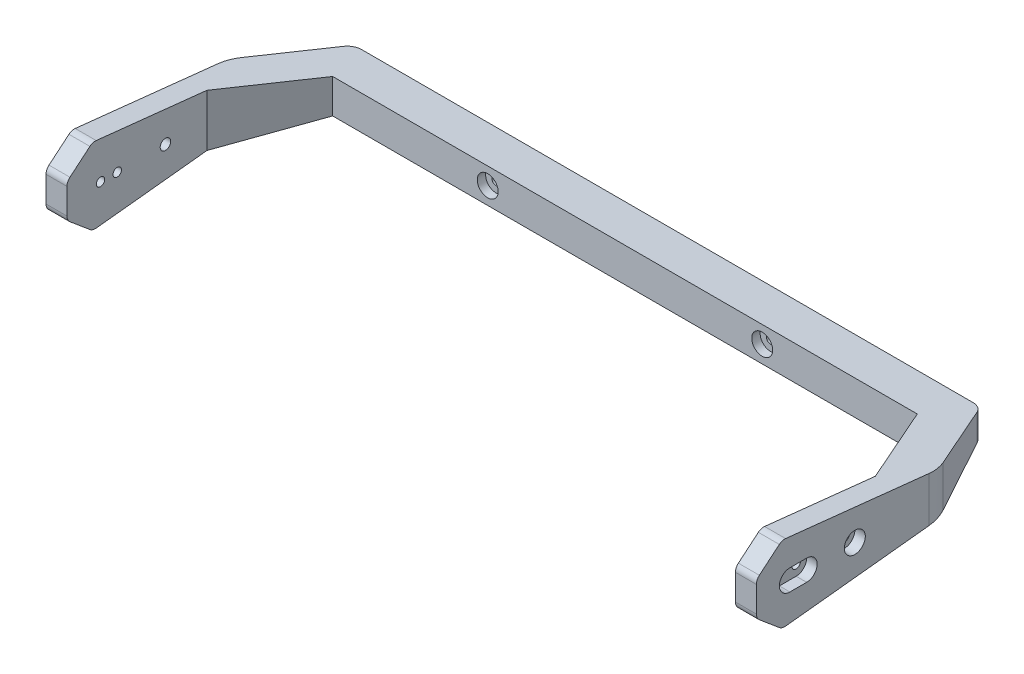
from build123d import *
from OCP.BRepFilletAPI import BRepFilletAPI_MakeChamfer

# Parameters (mm, degrees)
SKETCH4_R                       = 1
SKETCH4_R_2                     = 0.9999999999999998
SKETCH4_R_3                     = 1.250000000000001
BOSS_EXTRUDE1_DEPTH             = 5
BOSS_EXTRUDE2_START             = -79.75
BOSS_EXTRUDE2_DEPTH             = 159.5
BOSS_EXTRUDE3_REACH             = 103.717
SKETCH6_W                       = 14.25
SKETCH6_H                       = 2.1000000000000014
BOSS_EXTRUDE3_DIRECTION_2_REACH = 103.717
SKETCH11_R                      = 0.9999999999999983
CUT_EXTRUDE4_DEPTH              = 101.58679916039975
SKETCH12_R                      = 2.4999999999999982
SKETCH12_R_2                    = 2.500000000000002
CUT_EXTRUDE5_DEPTH              = 2
CUT_EXTRUDE6_START              = -2
SKETCH13_R                      = 2.4999999999999982
SKETCH13_R_2                    = 2.500000000000002
CUT_EXTRUDE6_DEPTH              = 2
CHAMFER3_SIZE                   = 10
CHAMFER3_SIZE2                  = 20
CHAMFER4_SIZE                   = 20
CHAMFER4_SIZE2                  = 10
BOSS_EXTRUDE4_START             = -65.5
BOSS_EXTRUDE4_DEPTH             = 131
SKETCH15_R                      = 2.4999999999999982
CUT_EXTRUDE7_DEPTH              = 2.5
FILLET1_R                       = 2
FILLET2_R                       = 10
FILLET3_R                       = 3


# Read off the part's stored shape, not the designer's step: Boss-Extrude4
with BuildPart() as part:
    # Sketch4 → Boss-Extrude1 (new body)
    with BuildSketch(Plane(origin=(79.75, 0, 0), x_dir=(0, 0, -1), z_dir=(1, 0, 0))):
        Polygon((-7.999999999999998, 4), (-7.999999999999998, -4), (-1.87164445504816, -9.142300877492296), (55.5, -3), (55.5, 3), (-1.8716444550481652, 9.142300877492302), align=None)
        Circle(SKETCH4_R, mode=Mode.SUBTRACT)
        with Locations((4, 0)):
            Circle(SKETCH4_R_2, mode=Mode.SUBTRACT)
        with Locations((15.5, 0)):
            Circle(SKETCH4_R_3, mode=Mode.SUBTRACT)
    extrude(amount=BOSS_EXTRUDE1_DEPTH)


with BuildPart() as body_2:
    # Mirror1: mirrored copy
    add(part.part.mirror(Plane(origin=(0, 0, 0), x_dir=(0, 0, 1), z_dir=(1, 0, 0))))


with BuildPart() as part_1:
    add(part.part)

    add(body_2.part)  # Boss-Extrude2 merges body 2
    # Sketch5 → Boss-Extrude2 (add)
    with BuildSketch(Plane(origin=(0, 0, 0), x_dir=(0, 0, -1), z_dir=(1, 0, 0)).offset(BOSS_EXTRUDE2_START)):
        Polygon((51.49999999999999, 3.428246457694266), (51.49999999999999, -3.428246457694267), (55.5, -3), (55.5, 3), align=None)
        Polygon((45.4, 4.081322305678019), (45.4, -4.081322305678019), (49.39999999999999, -3.6530758479837546), (49.39999999999999, 3.6530758479837546), align=None)
    extrude(amount=BOSS_EXTRUDE2_DEPTH)

    # Boss-Extrude3: up to this plane
    boss_extrude3_end = Plane(origin=(84.75, 3, -55.5), z_dir=(0, -0.9943177075979668, 0.10645325902537786))
    # Sketch6 → Boss-Extrude3 (add, up to the surface)
    with BuildSketch(Plane(origin=(0, 0, 0), x_dir=(1, 0, 0), z_dir=(0, 1, 0)), mode=Mode.PRIVATE) as boss_extrude3_sk1:
        with Locations((-72.625, 50.44999999999999)):
            Rectangle(SKETCH6_W, SKETCH6_H)
    boss_extrude3_tool1 = split(extrude(boss_extrude3_sk1.sketch, amount=BOSS_EXTRUDE3_REACH, mode=Mode.PRIVATE), bisect_by=boss_extrude3_end, keep=Keep.BOTH, mode=Mode.PRIVATE)
    add(boss_extrude3_tool1.solids().sort_by_distance((-72.625, 0, -50.45))[0])
    # Sketch6 → Boss-Extrude3 (add, up to the surface)
    with BuildSketch(Plane(origin=(0, 0, 0), x_dir=(1, 0, 0), z_dir=(0, 1, 0)), mode=Mode.PRIVATE) as boss_extrude3_sk2:
        Polygon((65.5, 49.400000000000006), (79.75, 49.39999999999999), (79.75, 51.49999999999999), (65.5, 51.50000000000001), align=None)
    boss_extrude3_tool2 = split(extrude(boss_extrude3_sk2.sketch, amount=BOSS_EXTRUDE3_REACH, mode=Mode.PRIVATE), bisect_by=boss_extrude3_end, keep=Keep.BOTH, mode=Mode.PRIVATE)
    add(boss_extrude3_tool2.solids().sort_by_distance((72.625, 0, -50.45))[0])

    # Boss-Extrude3 direction 2: up to this plane
    boss_extrude3_direction_2_end = Plane(origin=(84.75, -9.142300877492296, 1.87164445504816), z_dir=(0, 0.9943177075979668, 0.10645325902537779))
    # Sketch6 → Boss-Extrude3 direction 2 (add, up to the surface)
    with BuildSketch(Plane(origin=(0, 0, 0), x_dir=(1, 0, 0), z_dir=(0, 1, 0)), mode=Mode.PRIVATE) as boss_extrude3_direction_2_sk1:
        with Locations((-72.625, 50.44999999999999)):
            Rectangle(SKETCH6_W, SKETCH6_H)
    boss_extrude3_direction_2_tool1 = split(extrude(boss_extrude3_direction_2_sk1.sketch, amount=-BOSS_EXTRUDE3_DIRECTION_2_REACH, mode=Mode.PRIVATE), bisect_by=boss_extrude3_direction_2_end, keep=Keep.BOTH, mode=Mode.PRIVATE)
    add(boss_extrude3_direction_2_tool1.solids().sort_by_distance((-72.625, 0, -50.45))[0])
    # Sketch6 → Boss-Extrude3 direction 2 (add, up to the surface)
    with BuildSketch(Plane(origin=(0, 0, 0), x_dir=(1, 0, 0), z_dir=(0, 1, 0)), mode=Mode.PRIVATE) as boss_extrude3_direction_2_sk2:
        Polygon((65.5, 49.400000000000006), (79.75, 49.39999999999999), (79.75, 51.49999999999999), (65.5, 51.50000000000001), align=None)
    boss_extrude3_direction_2_tool2 = split(extrude(boss_extrude3_direction_2_sk2.sketch, amount=-BOSS_EXTRUDE3_DIRECTION_2_REACH, mode=Mode.PRIVATE), bisect_by=boss_extrude3_direction_2_end, keep=Keep.BOTH, mode=Mode.PRIVATE)
    add(boss_extrude3_direction_2_tool2.solids().sort_by_distance((72.625, 0, -50.45))[0])

    # Sketch11 → Cut-Extrude4 (cut, through all)
    with BuildSketch(Plane.XY.offset(-45.4)):
        with Locations((-32.75, -1.61e-15)):
            Circle(SKETCH11_R)
        with Locations((32.75, 2.4e-15)):
            Circle(SKETCH11_R)
    extrude(amount=-CUT_EXTRUDE4_DEPTH, mode=Mode.SUBTRACT)

    # Sketch12 → Cut-Extrude5 (cut)
    with BuildSketch(Plane.XY.offset(-45.4)):
        with Locations((-32.75, -1.73e-15)):
            Circle(SKETCH12_R)
        with Locations((32.75, 3.47e-15)):
            Circle(SKETCH12_R_2)
    extrude(amount=-CUT_EXTRUDE5_DEPTH, mode=Mode.SUBTRACT)

    # Sketch13 → Cut-Extrude6 (cut)
    with BuildSketch(Plane(origin=(0, 0, -55.5), x_dir=(-1, 0, 0), z_dir=(0, 0, -1)).offset(CUT_EXTRUDE6_START)):
        with Locations(Location((-32.75, 3.47e-15, 0), (0, 0, 180))):
            Circle(SKETCH13_R)
        with Locations(Location((32.75, 0, 0), (0, 0, 180))):
            Circle(SKETCH13_R_2)
    extrude(amount=CUT_EXTRUDE6_DEPTH, mode=Mode.SUBTRACT)

    # Chamfer3: one chamfer whose edges measure the first distance from different faces: ONE call of the kernel's chamfer builder (chamfer() names one face for all edges)
    chamfer3_edges_1 = [part_1.edges().sort_by_distance(p)[0] for p in [
        (84.75, 0, -55.5),
    ]]
    chamfer3_side_1 = [part_1.faces().sort_by_distance(p)[0] for p in [
        (6.55e-15, -1.2e-16, -55.5),
    ]]
    chamfer3_edges_2 = [part_1.edges().sort_by_distance(p)[0] for p in [
        (79.75, 0, -45.4),
    ]]
    chamfer3_side_2 = [part_1.faces().sort_by_distance(p)[0] for p in [
        (3.3e-16, 1.1e-16, -45.4),
    ]]
    chamfer3 = BRepFilletAPI_MakeChamfer(part_1.part.solid().wrapped)
    for e in chamfer3_edges_1:
        chamfer3.Add(CHAMFER3_SIZE, CHAMFER3_SIZE2, e.wrapped, chamfer3_side_1[0].wrapped)  # the first distance lies on this face
    for e in chamfer3_edges_2:
        chamfer3.Add(CHAMFER3_SIZE, CHAMFER3_SIZE2, e.wrapped, chamfer3_side_2[0].wrapped)  # the first distance lies on this face
    add(Compound.cast(chamfer3.Shape()), mode=Mode.REPLACE)

    # Chamfer4: one chamfer whose edges measure the first distance from different faces: ONE call of the kernel's chamfer builder (chamfer() names one face for all edges)
    chamfer4_edges_1 = [part_1.edges().sort_by_distance(p)[0] for p in [
        (-79.75, 0, -45.4),
    ]]
    chamfer4_side_1 = [part_1.faces().sort_by_distance(p)[0] for p in [
        (-79.75, 6.138766924124398, 4.573009379877834),
    ]]
    chamfer4_edges_2 = [part_1.edges().sort_by_distance(p)[0] for p in [
        (-84.75, 0, -55.5),
    ]]
    chamfer4_side_2 = [part_1.faces().sort_by_distance(p)[0] for p in [
        (-84.75, 2.08e-15, -19.394723563601886),
    ]]
    chamfer4 = BRepFilletAPI_MakeChamfer(part_1.part.solid().wrapped)
    for e in chamfer4_edges_1:
        chamfer4.Add(CHAMFER4_SIZE, CHAMFER4_SIZE2, e.wrapped, chamfer4_side_1[0].wrapped)  # the first distance lies on this face
    for e in chamfer4_edges_2:
        chamfer4.Add(CHAMFER4_SIZE, CHAMFER4_SIZE2, e.wrapped, chamfer4_side_2[0].wrapped)  # the first distance lies on this face
    add(Compound.cast(chamfer4.Shape()), mode=Mode.REPLACE)

    # Boss-Extrude4 outline → Boss-Extrude4 (add)
    with BuildSketch(Plane.YZ.offset(BOSS_EXTRUDE4_START)):
        Polygon((3.428246458, -51.5), (3.653075848, -49.4), (2.5, -49.4), (2.5, -51.5), align=None)
    extrude(amount=BOSS_EXTRUDE4_DEPTH)

    # Sketch15 → Cut-Extrude7 (cut)
    with BuildSketch(Plane(origin=(84.75, 0, 0), x_dir=(0, 0, -1), z_dir=(1, 0, 0))):
        with Locations((15.5, 0)):
            Circle(SKETCH15_R)
        with BuildLine():
            Line((4, 2.5), (0, 2.5))
            ThreePointArc((0, 2.5), (-2.5, 3.1e-16), (0, -2.5))
            Line((0, -2.5), (4, -2.5))
            ThreePointArc((4, -2.5), (6.5, 0), (4, 2.5))
        make_face()
    cut_extrude7 = extrude(amount=-CUT_EXTRUDE7_DEPTH, mode=Mode.SUBTRACT)

    # Mirror2: Cut-Extrude7 across plane
    add(cut_extrude7.mirror(Plane(origin=(0, 0, 0), x_dir=(0, 0, 1), z_dir=(1, 0, 0))), mode=Mode.SUBTRACT)

    # Fillet1
    fillet1_edges = [part_1.edges().sort_by_distance(p)[0] for p in [
        (82.25, 9.142300877492302, 1.8716444550481652),
        (82.25, -9.142300877492296, 1.87164445504816),
        (82.25, -4, 7.999999999999998),
        (82.25, 4, 7.999999999999998),
        (-82.25, 4, 7.999999999999998),
        (-82.25, -4, 7.999999999999998),
        (-82.25, -9.142300877492296, 1.87164445504816),
        (-82.25, 9.142300877492302, 1.8716444550481652),
    ]]
    fillet(fillet1_edges, radius=FILLET1_R)

    # Fillet2
    fillet2_edges = [part_1.edges().sort_by_distance(p)[0] for p in [
        (84.75, 8.9e-16, -35.5),
        (-84.75, 8.9e-16, -35.5),
    ]]
    fillet(fillet2_edges, radius=FILLET2_R)

    # Fillet3
    fillet3_edges = [part_1.edges().sort_by_distance(p)[0] for p in [
        (74.75, 0, -55.5),
        (-74.75, 0, -55.5),
    ]]
    fillet(fillet3_edges, radius=FILLET3_R)


solid = part_1.part
